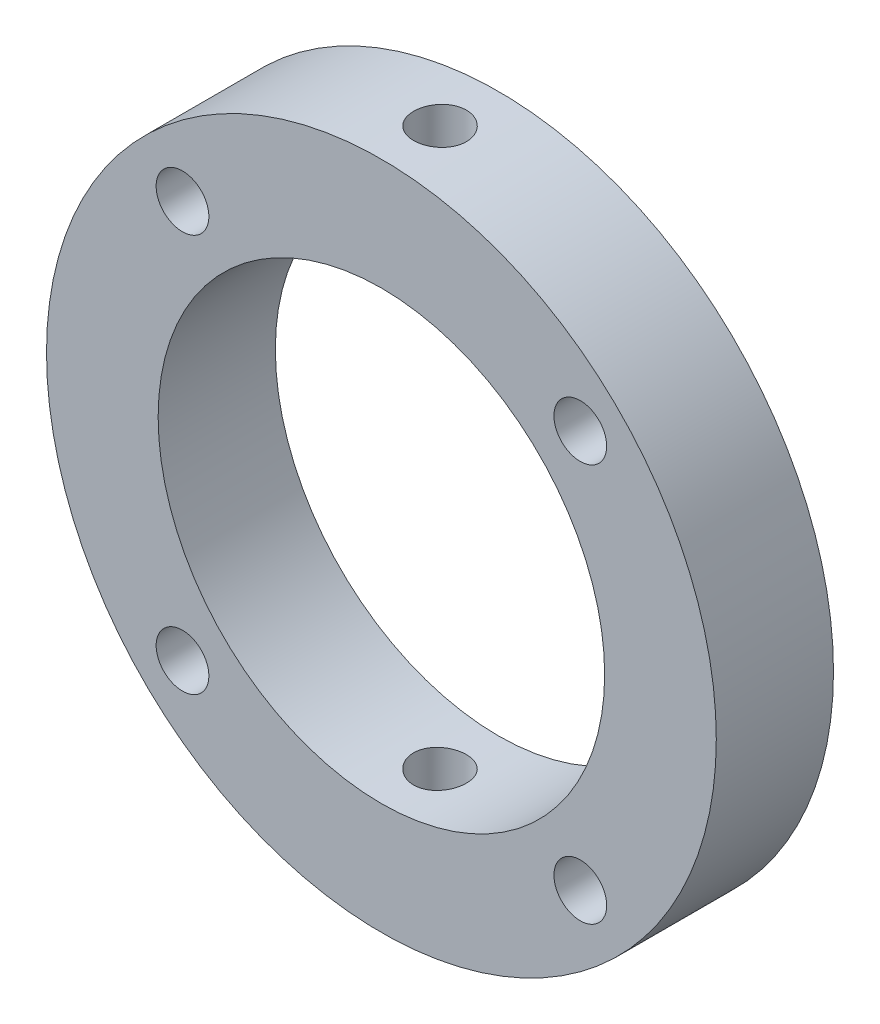
from build123d import *

# Parameters (mm, degrees)
SKETCH1_R           = 28.575
BOSS_EXTRUDE1_DEPTH = 10
SKETCH2_R           = 19.05
CUT_EXTRUDE1_DEPTH  = 42.630052246
SKETCH5_R           = 2.25
CUT_EXTRUDE2_DEPTH  = 65.673434461
SKETCH6_R           = 2.25
CUT_EXTRUDE3_DEPTH  = 42.630052425


with BuildPart() as part:
    # Sketch1 → Boss-Extrude1 (new body)
    with BuildSketch(Plane.XY):
        Circle(SKETCH1_R)
    extrude(amount=BOSS_EXTRUDE1_DEPTH)

    # Sketch2 → Cut-Extrude1 (cut, through all)
    with BuildSketch(Plane.XY.offset(10)):
        Circle(SKETCH2_R)
    extrude(amount=-CUT_EXTRUDE1_DEPTH, mode=Mode.SUBTRACT)

    # Sketch5 → Cut-Extrude2 (cut, through all)
    with BuildSketch(Plane(origin=(0, 28.575, 0), x_dir=(1, 0, 0), z_dir=(0, 1, 0))):
        with Locations((0, -5)):
            Circle(SKETCH5_R)
    extrude(amount=-CUT_EXTRUDE2_DEPTH, mode=Mode.SUBTRACT)

    # Sketch6 → Cut-Extrude3 (cut, through all)
    with BuildSketch(Plane.XY.offset(10)):
        with Locations((-16.970562748, 16.970562748)):
            Circle(SKETCH6_R)
        with Locations((16.970562748, 16.970562748)):
            Circle(SKETCH6_R)
        with Locations((16.970562748, -16.970562748)):
            Circle(SKETCH6_R)
        with Locations((-16.970562748, -16.970562748)):
            Circle(SKETCH6_R)
    extrude(amount=-CUT_EXTRUDE3_DEPTH, mode=Mode.SUBTRACT)


solid = part.part
